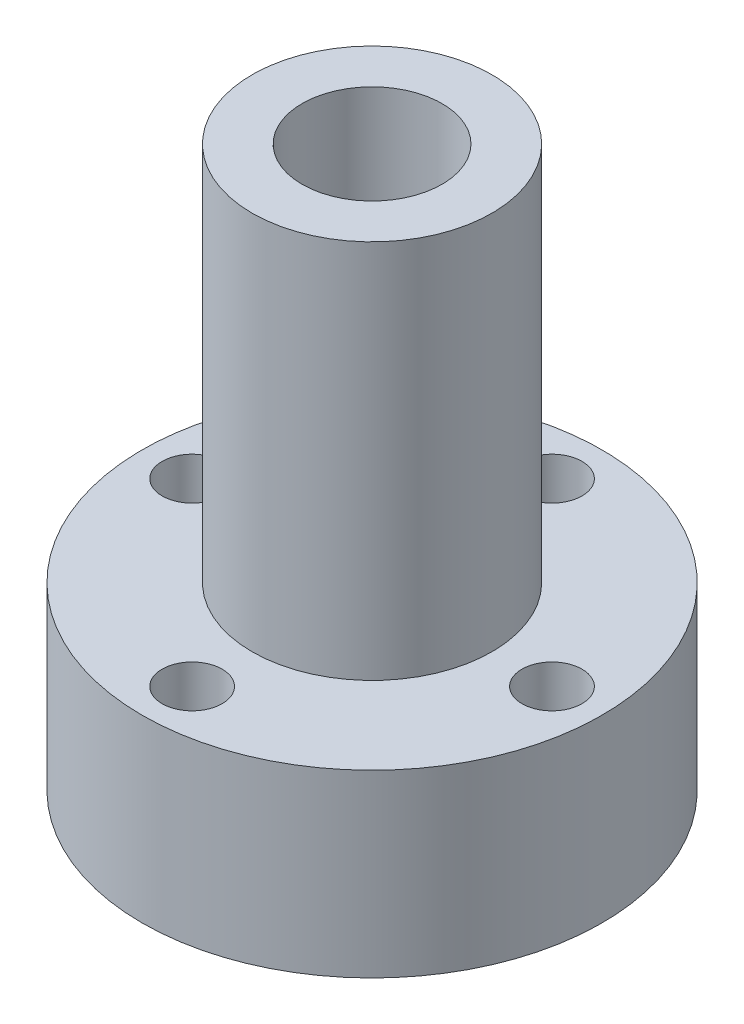
from build123d import *

# Parameters (mm, degrees)
SZKIC2_R                   = 3
WYTNIJ_WYCI_GNI_CIE1_DEPTH = 65.761099435


with BuildPart() as part:
    # Szkic1 → Obrót1 (revolve)
    with BuildSketch(Plane.XY):
        Polygon((-23, -9.5), (-12, -9.5), (-12, 28.5), (-7, 28.5), (-7, -29.5), (-10, -29.5), (-10, -27.5), (-23, -27.5), align=None)
    revolve(axis=Axis((0, 0, 0), (0, -1, 0)))

    # Szkic2 → Wytnij-wyciągnięcie1 (cut, through all)
    with BuildSketch(Plane.XZ.offset(27.5)):
        with Locations((0, 18)):
            Circle(SZKIC2_R)
        with Locations((18, 0)):
            Circle(SZKIC2_R)
        with Locations((0, -18)):
            Circle(SZKIC2_R)
        with Locations((-18, 0)):
            Circle(SZKIC2_R)
    extrude(amount=-WYTNIJ_WYCI_GNI_CIE1_DEPTH, mode=Mode.SUBTRACT)


solid = part.part
